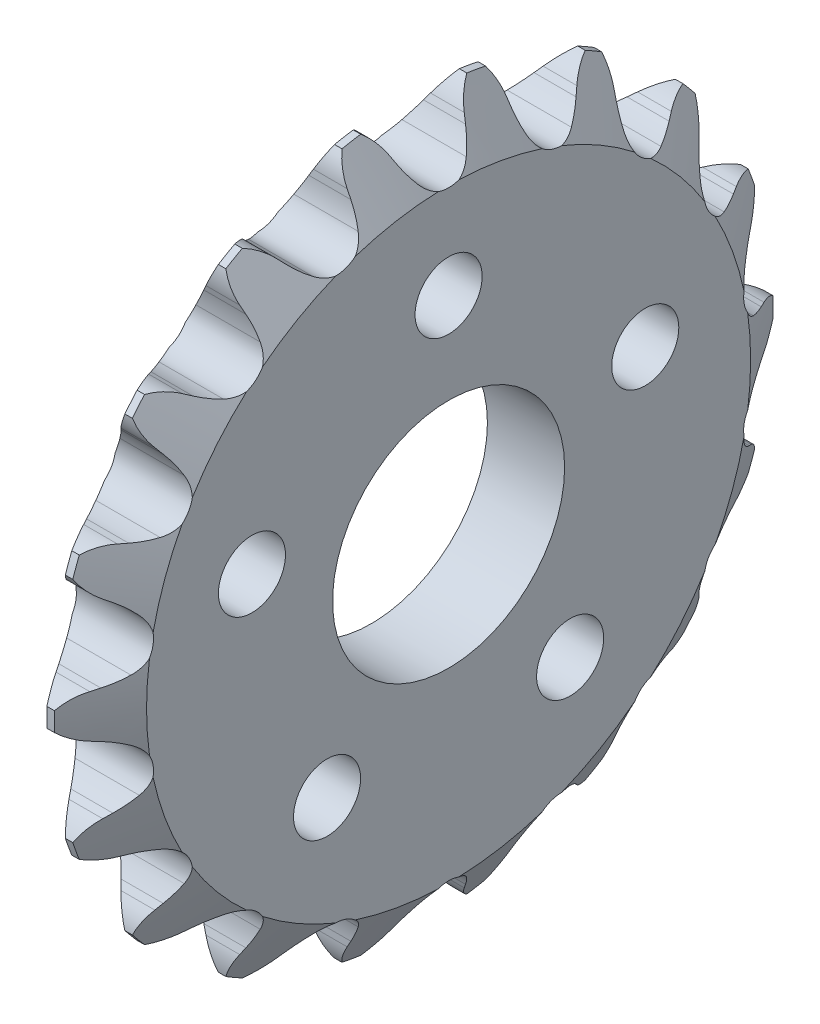
from build123d import *

# Parameters (mm, degrees)
CUT_EXTRUDE1_DEPTH = 29.183557737
CIRPATTERN1_COUNT  = 18
SKETCH4_R          = 6.4135
SKETCH4_R_2        = 1.8542
CUT_EXTRUDE2_DEPTH = 29.273117331


with BuildPart() as part:
    # Sketch2 → Revolve1 (revolve)
    with BuildSketch(Plane.XY):
        Polygon((-0.206375, 19.871596284), (0.206375, 19.871596284), (2.1336, 16.696596284), (2.1336, 0), (-2.1336, 0), (-2.1336, 16.696596284), align=None)
    revolve(axis=Axis((-2.1336, 0, 0), (1, 0, 0)))

    # Sketch3 → Cut-Extrude1 (cut, symmetric)
    with BuildSketch(Plane(origin=(0, 0, 0), x_dir=(0, 0, -1), z_dir=(1, 0, 0))):
        with BuildLine():
            Line((-2.066224101, 18.559583724), (-1.908645709, 18.196215131))
            ThreePointArc((-1.908645709, 18.196215131), (-1.651424634, 17.695000021), (-1.331431851, 17.231336472))
            ThreePointArc((-1.331431851, 17.231336472), (0, 16.586741284), (1.331431851, 17.231336472))
            ThreePointArc((1.331431851, 17.231336472), (1.651424634, 17.695000021), (1.908645709, 18.196215131))
            Line((1.908645709, 18.196215131), (2.066224101, 18.559583724))
            ThreePointArc((2.066224101, 18.559583724), (2.655633711, 19.416846104), (3.524580563, 19.988889671))
            ThreePointArc((3.524580563, 19.988889671), (0, 20.297250514), (-3.524580563, 19.988889671))
            ThreePointArc((-3.524580563, 19.988889671), (-2.655633711, 19.416846104), (-2.066224101, 18.559583724))
        make_face()
    cut_extrude1 = extrude(amount=CUT_EXTRUDE1_DEPTH, both=True, mode=Mode.SUBTRACT)

    # CirPattern1: Cut-Extrude1 ×18 about axis
    cirpattern1_axis = Axis((-88.99, 0, 0), (1, 0, 0))
    for i in range(1, CIRPATTERN1_COUNT):
        add(cut_extrude1.rotate(cirpattern1_axis, i * 360 / CIRPATTERN1_COUNT), mode=Mode.SUBTRACT)

    # Sketch4 → Cut-Extrude2 (cut, through all)
    with BuildSketch(Plane(origin=(2.1336, 0, 0), x_dir=(0, 0, -1), z_dir=(1, 0, 0))):
        Circle(SKETCH4_R)
        with Locations((0, 11.43)):
            Circle(SKETCH4_R_2)
        with Locations((10.870575981, 3.532064246)):
            Circle(SKETCH4_R_2)
        with Locations((6.718385434, -9.247064246)):
            Circle(SKETCH4_R_2)
        with Locations((-6.718385434, -9.247064246)):
            Circle(SKETCH4_R_2)
        with Locations((-10.870575981, 3.532064246)):
            Circle(SKETCH4_R_2)
    extrude(amount=-CUT_EXTRUDE2_DEPTH, mode=Mode.SUBTRACT)


solid = part.part
